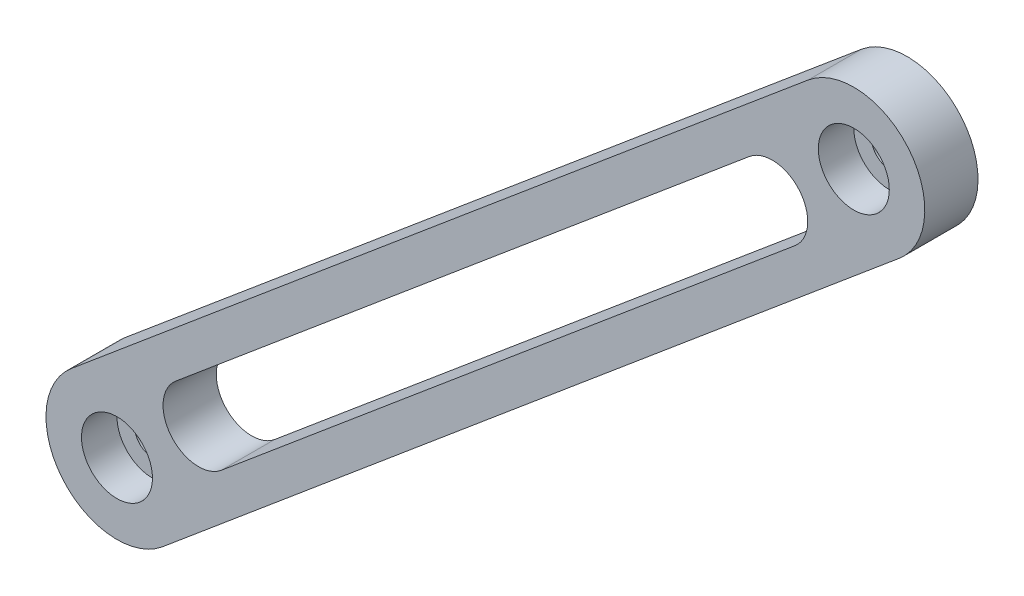
from build123d import *

# Parameters (mm, degrees)
SKETCH1_R           = 6.35
BOSS_EXTRUDE1_DEPTH = 19.05
SKETCH2_R           = 12.7
CUT_EXTRUDE1_DEPTH  = 12.7


with BuildPart() as part:
    # Sketch1 → Boss-Extrude1 (new body)
    with BuildSketch(Plane.XY):
        with BuildLine():
            Line((568.345160721, 503.256723569), (304.695644733, 282.028511943))
            ThreePointArc((304.695644733, 282.028511943), (301.564919628, 246.244179632), (337.349251645, 243.113451162))
            Line((337.349251645, 243.113451162), (600.998771294, 464.341665859))
            ThreePointArc((600.998771294, 464.341665859), (604.129494863, 500.126), (568.345160721, 503.256723569))
        make_face()
        with Locations((321.022448189, 262.570981553)):
            Circle(SKETCH1_R, mode=Mode.SUBTRACT)
        with Locations((584.671966007, 483.799194714)):
            Circle(SKETCH1_R, mode=Mode.SUBTRACT)
        with BuildLine():
            Line((563.649075368, 449.580222357), (358.372145945, 277.33242659))
            ThreePointArc((358.372145945, 277.33242659), (340.479978874, 278.897788374), (342.045340659, 296.789955445))
            Line((342.045340659, 296.789955445), (547.322270082, 469.037751213))
            ThreePointArc((547.322270082, 469.037751213), (565.214437152, 467.472389428), (563.649075368, 449.580222357))
        make_face(mode=Mode.SUBTRACT)
    extrude(amount=BOSS_EXTRUDE1_DEPTH)

    # Sketch2 → Cut-Extrude1 (cut)
    with BuildSketch(Plane.XY.offset(19.05)):
        with Locations((321.022448189, 262.570981553)):
            Circle(SKETCH2_R)
        with Locations((584.671966007, 483.799194714)):
            Circle(SKETCH2_R)
    extrude(amount=-CUT_EXTRUDE1_DEPTH, mode=Mode.SUBTRACT)


solid = part.part
